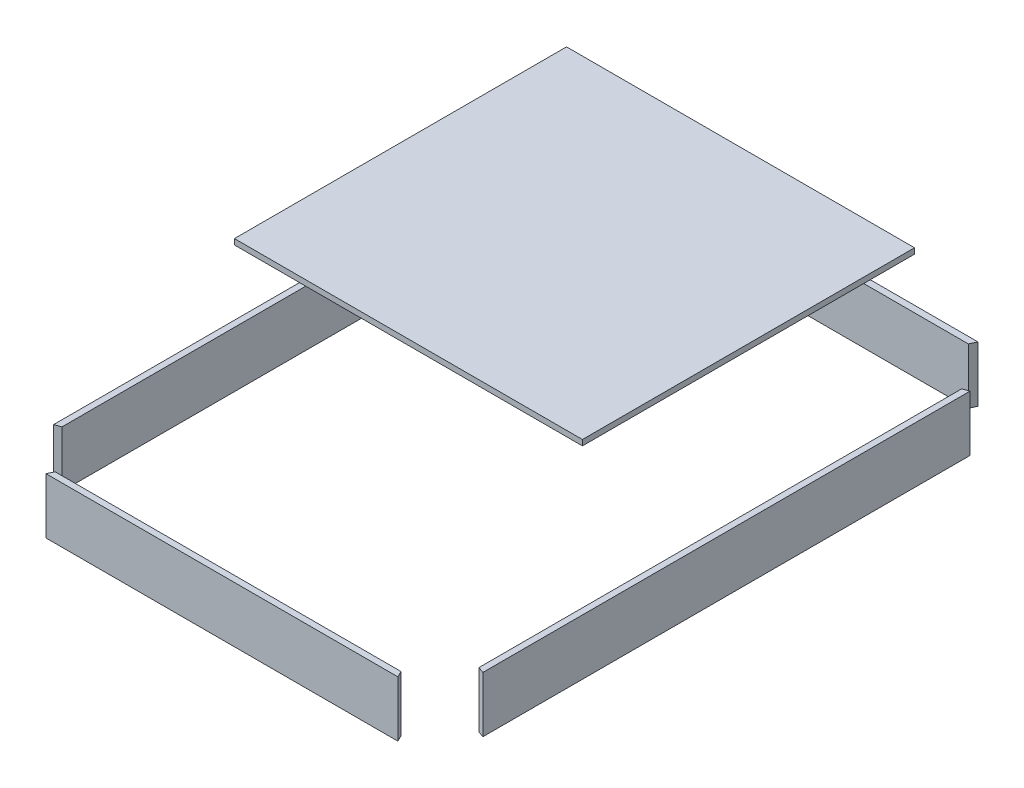
from build123d import *

# Parameters (mm, degrees)
BOSS_EXTRUDE2_START   = -2.54
SKETCH11_W            = 158.590306042
SKETCH11_H            = 151.335344101
BOSS_EXTRUDE2_DEPTH   = 2.54
BOSS_EXTRUDE3_DEPTH   = 25.4
BOSS_EXTRUDE3_2_DEPTH = 25.4
BOSS_EXTRUDE3_3_DEPTH = 25.4
BOSS_EXTRUDE3_4_DEPTH = 25.4


with BuildPart() as part:
    # Sketch11 → Boss-Extrude2 (new body)
    with BuildSketch(Plane(origin=(0, 50.8, 0), x_dir=(1, 0, 0), z_dir=(0, 1, 0)).offset(BOSS_EXTRUDE2_START)):
        with Locations((0.079846979, 28.487485648)):
            Rectangle(SKETCH11_W, SKETCH11_H)
    extrude(amount=BOSS_EXTRUDE2_DEPTH)


with BuildPart() as body_2:
    # Sketch12 → Boss-Extrude3 (new body)
    with BuildSketch(Plane.XZ):
        Polygon((-97.807424573, -111.03828165), (-94.994623574, -109.985875572), (-94.993617931, 109.989389131), (-97.813974457, 111.011381019), align=None)
    extrude(amount=BOSS_EXTRUDE3_DEPTH)


with BuildPart() as body_3:
    # Sketch12 → Boss-Extrude3 2 (new body)
    with BuildSketch(Plane.XZ):
        Polygon((-78.799077158, 129.283704503), (78.799077158, 129.283704503), (80.166053285, 132.104464391), (-80.166053285, 132.104464391), align=None)
    extrude(amount=BOSS_EXTRUDE3_2_DEPTH)


with BuildPart() as body_4:
    # Sketch12 → Boss-Extrude3 3 (new body)
    with BuildSketch(Plane.XZ):
        Polygon((94.993617931, 109.989389131), (97.813974457, 111.011381019), (97.807424573, -111.03828165), (94.994623574, -109.985875572), align=None)
    extrude(amount=BOSS_EXTRUDE3_3_DEPTH)


with BuildPart() as body_5:
    # Sketch12 → Boss-Extrude3 4 (new body)
    with BuildSketch(Plane.XZ):
        Polygon((78.796040757, -129.268825831), (80.200678396, -132.258104784), (-80.200678396, -132.258104784), (-78.796040757, -129.268825831), align=None)
    extrude(amount=BOSS_EXTRUDE3_4_DEPTH)


solid = Compound([part.part, body_2.part, body_3.part, body_4.part, body_5.part])
